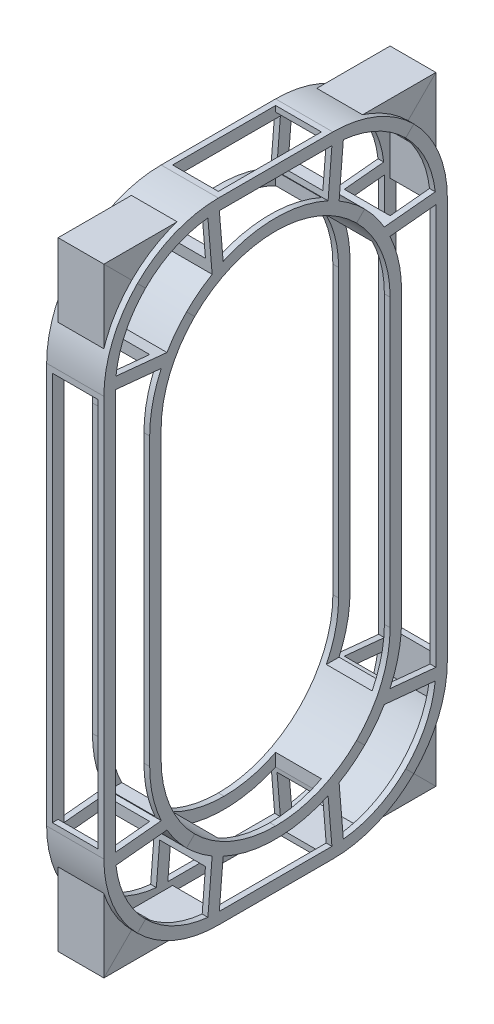
from build123d import *

# Parameters (mm, degrees)
FILLET3_R           = 100
CUT_EXTRUDE2_DEPTH  = 616.4266812545585
CUT_EXTRUDE3_DEPTH  = 606.1859218455102
CUT_EXTRUDE18_DEPTH = 595.7688626685159


with BuildPart() as part:
    # Sweep1: sweep along a path in Sketch3
    with BuildLine(Plane(origin=(0, 0, 0), x_dir=(0, 0, -1), z_dir=(1, 0, 0))) as sweep1_path:
        Line((0, 0), (0, 500))
        Line((0, 500), (250, 500))
        Line((250, 500), (250.00000000000006, 6.12e-15))
        Line((250.00000000000006, 6.12e-15), (0, 0))
    # Sketch2 → Sweep1 (sweep)
    with BuildSketch(Plane(origin=(0, 0, 0), x_dir=(1, 0, 0), z_dir=(0, 1, 0))):
        Polygon((25, -25), (-25, -25.00000000000001), (-25, 24.999999999999993), (25, 24.999999999999996), align=None)
        Polygon((20, 19.999999999999996), (-20, 19.99999999999999), (-20, -20.000000000000007), (20, -20), align=None, mode=Mode.SUBTRACT)
    sweep(path=sweep1_path.line, transition=Transition.RIGHT)

    # Fillet3
    fillet3_edges = [part.edges().sort_by_distance(p)[0] for p in [
        (0, 25, -225),
        (0, 25, -24.999999999999996),
        (0, 475, -225),
        (0, 475, -24.999999999999996),
    ]]
    fillet(fillet3_edges, radius=FILLET3_R - 0.0001)  # a hair under: the kernel refuses the full size
    fillet3_2_edges = [part.edges().sort_by_distance(p)[0] for p in [
        (-3.55e-15, 525, -275),
        (-3.55e-15, -25.000000000000004, -275),
        (-3.55e-15, -25.00000000000001, 25.000000000000007),
        (-3.55e-15, 525, 25.000000000000007),
    ]]
    fillet(fillet3_2_edges, radius=FILLET3_R)

    # Sketch5 → Cut-Extrude2 (cut, through all)
    with BuildSketch(Plane.XZ.offset(25.000000000000014)):
        Polygon((-20.000000000000007, -170.00000000000006), (19.999999999999993, -170.00000000000006), (19.999999999999993, -79.99999999999999), (-20.000000000000007, -79.99999999999996), align=None)
    extrude(amount=-CUT_EXTRUDE2_DEPTH, mode=Mode.SUBTRACT)

    # Sketch6 → Cut-Extrude3 (cut, through all)
    with BuildSketch(Plane.XY.offset(25.000000000000007)):
        Polygon((-20.000000000000007, 420.00000000000006), (-20.000000000000007, 79.99999999999997), (19.999999999999993, 79.99999999999999), (19.999999999999993, 420.00000000000006), align=None)
    extrude(amount=-CUT_EXTRUDE3_DEPTH, mode=Mode.SUBTRACT)

    # Sketch19 → Cut-Extrude18 (cut, through all)
    with BuildSketch(Plane.ZY.offset(25)):
        with BuildLine():
            ThreePointArc((-224.89347851891705, 421.05749612593655), (-232.44366579068512, 398.57665543412725), (-235.00000000000003, 375))
            Line((-235.00000000000003, 375), (-235.00000000000006, 125))
            ThreePointArc((-235.00000000000006, 125), (-232.44366579068517, 101.42334456587275), (-224.89347851891705, 78.94250387406343))
            Line((-224.89347851891705, 78.94250387406343), (-265.0000000000001, 74.99999999999996))
            Line((-265.0000000000001, 74.99999999999996), (-265, 425.00000000000006))
            Line((-265, 425.00000000000006), (-224.89347851891705, 421.05749612593655))
        make_face()
        with BuildLine():
            ThreePointArc((-238.63961030678925, 488.63961030678945), (-256.1053768922045, 464.0117653942177), (-264.44344676082267, 434.9934894578369))
            Line((-264.44344676082267, 434.9934894578369), (-219.90488415304466, 430.61531231501976))
            ThreePointArc((-219.90488415304463, 430.61531231501976), (-212.0517417816099, 442.2457749809452), (-202.7817459305202, 452.78174593052023))
            Line((-202.7817459305202, 452.78174593052023), (-238.63961030678934, 488.6396103067894))
        make_face()
        with BuildLine():
            ThreePointArc((-184.1609145540828, 514.532550754085), (-213.63405487722474, 506.2859754431452), (-238.63961030678925, 488.63961030678945))
            Line((-238.63961030678934, 488.6396103067894), (-202.7817459305202, 452.78174593052023))
            ThreePointArc((-202.78174593052017, 452.78174593052023), (-192.16702134643737, 462.1125205894492), (-180.4435650027513, 470.00532142877944))
            Line((-180.4435650027513, 470.00532142877944), (-184.1609145540828, 514.532550754085))
        make_face()
        with BuildLine():
            ThreePointArc((-79.17424305044158, 475), (-101.54792120088285, 482.4709263010234), (-125, 485))
            ThreePointArc((-125, 485), (-148.45207879911717, 482.4709263010234), (-170.82575694955844, 475))
            Line((-170.82575694955844, 475), (-174.16515138991173, 515))
            Line((-174.16515138991173, 515), (-75.83484861008839, 515))
            Line((-75.83484861008839, 515), (-79.17424305044158, 475))
        make_face()
        with BuildLine():
            Line((-47.21825406947977, 452.7817459305203), (-11.360389693210657, 488.6396103067894))
            ThreePointArc((-11.36038969321067, 488.6396103067894), (-36.365945122775244, 506.2859754431452), (-65.83908544591725, 514.532550754085))
            Line((-65.83908544591723, 514.532550754085), (-69.55643499724876, 470.00532142877944))
            ThreePointArc((-69.55643499724874, 470.00532142877944), (-57.83297865356265, 462.11252058944933), (-47.21825406947981, 452.78174593052034))
        make_face()
        with BuildLine():
            Line((-30.0951158469554, 430.61531231501976), (14.443446760822598, 434.9934894578369))
            ThreePointArc((14.443446760822624, 434.9934894578369), (6.105376892204447, 464.0117653942176), (-11.36038969321067, 488.6396103067894))
            Line((-11.360389693210657, 488.6396103067894), (-47.21825406947977, 452.7817459305203))
            ThreePointArc((-47.21825406947981, 452.78174593052034), (-37.94825821839011, 442.24577498094527), (-30.09511584695541, 430.61531231501976))
        make_face()
        with BuildLine():
            ThreePointArc((-25.106521481082943, 78.94250387406343), (-17.556334209314883, 101.42334456587272), (-15.000000000000027, 125))
            Line((-15.000000000000027, 125), (-14.999999999999995, 375))
            ThreePointArc((-14.999999999999995, 375), (-17.556334209314898, 398.57665543412725), (-25.106521481082943, 421.05749612593655))
            Line((-25.106521481082943, 421.05749612593655), (15.00000000000007, 425.00000000000006))
            Line((15.00000000000007, 425.00000000000006), (15.000000000000012, 74.99999999999997))
            Line((15.000000000000012, 74.99999999999997), (-25.106521481082943, 78.94250387406343))
        make_face()
        with BuildLine():
            Line((14.443446760822598, 65.00651054216311), (-30.0951158469554, 69.38468768498025))
            ThreePointArc((-30.0951158469554, 69.38468768498025), (-37.948258218390094, 57.754225019054786), (-47.2182540694798, 47.218254069479784))
            ThreePointArc((-47.2182540694798, 47.218254069479784), (-57.832978653562634, 37.887479410550725), (-69.55643499724876, 29.994678571220568))
            Line((-69.55643499724876, 29.994678571220568), (-65.83908544591723, -14.532550754084966))
            ThreePointArc((-65.83908544591723, -14.532550754084966), (-36.36594512277525, -6.285975443145162), (-11.360389693210696, 11.360389693210667))
            ThreePointArc((-11.360389693210696, 11.360389693210667), (6.105376892204447, 35.98823460578241), (14.443446760822598, 65.00651054216311))
        make_face()
        with BuildLine():
            ThreePointArc((-125.00000000000003, 15), (-101.54792120088285, 17.529073698976617), (-79.17424305044158, 25.00000000000002))
            Line((-79.17424305044158, 25.00000000000002), (-75.8348486100883, -15.00000000000004))
            Line((-75.8348486100883, -15.00000000000004), (-174.16515138991173, -15.000000000000016))
            Line((-174.16515138991173, -15.000000000000016), (-170.82575694955844, 25.00000000000002))
            ThreePointArc((-170.82575694955844, 25.00000000000002), (-148.45207879911717, 17.52907369897663), (-125.00000000000003, 15))
        make_face()
        with BuildLine():
            ThreePointArc((-264.44344676082267, 65.00651054216311), (-256.1053768922045, 35.9882346057824), (-238.63961030678936, 11.360389693210667))
            ThreePointArc((-238.63961030678936, 11.360389693210667), (-213.6340548772248, -6.285975443145162), (-184.1609145540828, -14.532550754084966))
            Line((-184.1609145540828, -14.532550754084966), (-180.4435650027513, 29.994678571220568))
            ThreePointArc((-180.4435650027513, 29.994678571220568), (-192.16702134643742, 37.88747941055071), (-202.7817459305203, 47.218254069479755))
            ThreePointArc((-202.7817459305203, 47.218254069479755), (-212.05174178160996, 57.754225019054815), (-219.90488415304466, 69.38468768498025))
            Line((-219.90488415304466, 69.38468768498025), (-264.44344676082267, 65.00651054216311))
        make_face()
    extrude(amount=-CUT_EXTRUDE18_DEPTH, mode=Mode.SUBTRACT)


solid = part.part
